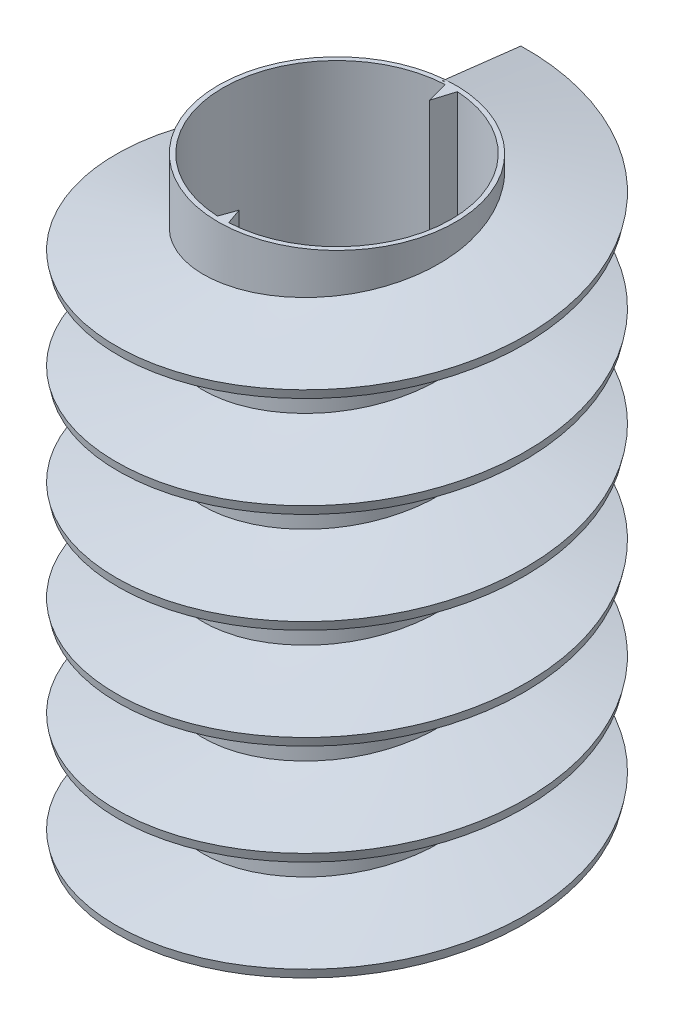
from build123d import *

# Parameters (mm, degrees)
SKETCH1_R           = 2.6
BOSS_EXTRUDE1_DEPTH = 13
CUT_EXTRUDE1_DEPTH  = 14.509996299
SWEEP1_PITCH        = 2.2


with BuildPart() as part:
    # Sketch1 → Boss-Extrude1 (new body)
    with BuildSketch(Plane(origin=(0, 0, 0), x_dir=(1, 0, 0), z_dir=(0, 1, 0))):
        with Locations(Location((0, 0, 0), (0, 0, 90))):
            Circle(SKETCH1_R)
    extrude(amount=BOSS_EXTRUDE1_DEPTH)

    # Sketch2 → Cut-Extrude1 (cut, through all)
    with BuildSketch(Plane(origin=(0, 13, 0), x_dir=(1, 0, 0), z_dir=(0, 1, 0))):
        with BuildLine():
            ThreePointArc((2.5, 0), (1.817534383, 1.716557242), (0.142744987, 2.495921447))
            Line((0.142744987, 2.495921447), (0, 2.026774479))
            Line((0, 2.026774479), (-0.124141084, 2.496915896))
            ThreePointArc((-0.124141084, 2.496915896), (-2.5, 0), (-0.124141084, -2.496915896))
            Line((-0.124141084, -2.496915896), (0, -2.145737669))
            Line((0, -2.145737669), (0.124141084, -2.496915896))
            ThreePointArc((0.124141084, -2.496915896), (1.811125715, -1.723317627), (2.5, 0))
        make_face()
    extrude(amount=-CUT_EXTRUDE1_DEPTH, mode=Mode.SUBTRACT)

    # Sweep1: arcs per turn and ends read off the stored shape
    # Sweep1: the profile of Sketch8 screwed along a right-hand helix through 6 turns, 10 arcs to a turn; built about Z, then put on its axis
    sweep1_z = Axis((0, 0, 0), (0, 0, 1))
    sweep1_corners = [(2.54938652, 0.000822651, -0.006108666), (4.502269345, -0.056776115, 0.421595734), (4.459112808, -0.082840218, 0.615136882), (2.506229983, -0.025241451, 0.187432482)]
    with BuildLine(mode=Mode.PRIVATE) as sweep1_profile:
        Line(sweep1_corners[0], sweep1_corners[1])
        Line(sweep1_corners[1], sweep1_corners[2])
        Line(sweep1_corners[2], sweep1_corners[3])
        Line(sweep1_corners[3], sweep1_corners[0])
    sweep1_cap = Face(sweep1_profile.wire())
    sweep1_turn_angles = [0, 18, 36, 54, 72, 90, 108, 126, 144, 162, 180, 198, 216, 234, 252, 270, 288, 306, 324, 342, 360]
    sweep1_turn_weights = [1, 0.9510565162951535, 1, 0.9510565162951535, 1, 0.9510565162951535, 1, 0.9510565162951535, 1, 0.9510565162951535, 1, 0.9510565162951535, 1, 0.9510565162951535, 1, 0.9510565162951535, 1, 0.9510565162951535, 1, 0.9510565162951535, 1]
    sweep1_turn_rails = [Edge.make_bspline([Vector(p[0], p[1], 0).rotate(sweep1_z, sweep1_turn_angles[k]) / sweep1_turn_weights[k] + Vector(0, 0, p[2] + SWEEP1_PITCH * sweep1_turn_angles[k] / 360) for k in range(21)], [0, 0, 0, 1, 1, 2, 2, 3, 3, 4, 4, 5, 5, 6, 6, 7, 7, 8, 8, 9, 9, 10, 10, 10], 2, sweep1_turn_weights) for p in sweep1_corners]
    sweep1_turn_sides = [Face.make_surface_from_curves(sweep1_turn_rails[p[0]], sweep1_turn_rails[p[1]]) for p in [(0, 1), (1, 2), (2, 3), (3, 0)]]
    sweep1 = Plane(origin=(0, 13, 0), x_dir=(-0.08715574274767476, 0, -0.9961946980917442), z_dir=(0, -1, 0)) * Solid(Shell([*[p.moved(Location((0, 0, SWEEP1_PITCH * i))) for i in range(6) for p in sweep1_turn_sides], sweep1_cap, sweep1_cap.rotate(sweep1_z, 2160).moved(Location((0, 0, SWEEP1_PITCH * 2160 / 360)))]))
    add(sweep1)


solid = part.part
